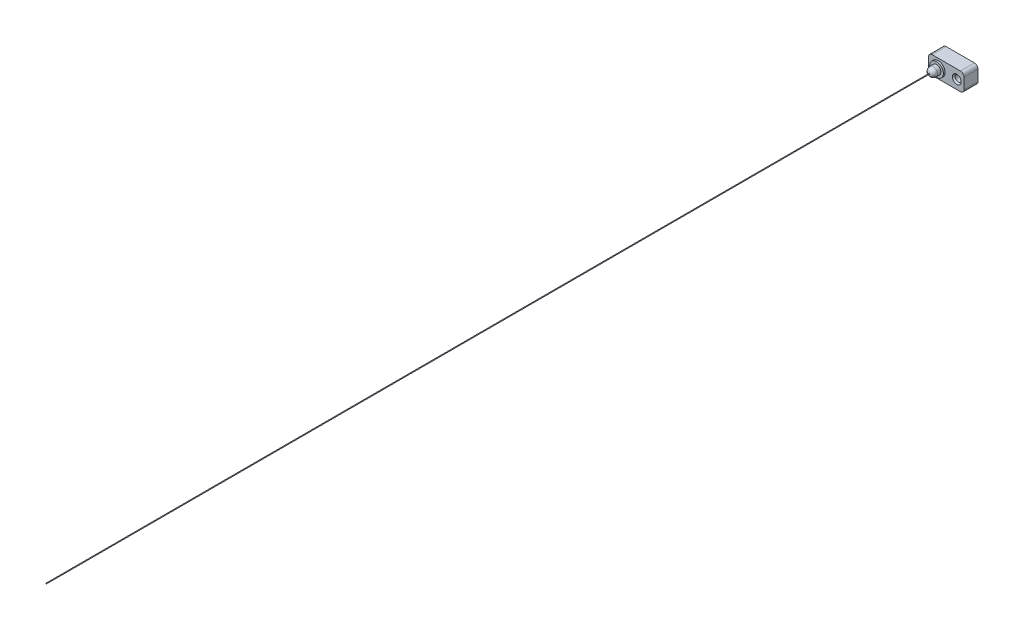
from build123d import *

# Parameters (mm, degrees)
SKETCH1_W                     = 20.066
SKETCH1_H                     = 10.16
BOSS_EXTRUDE1_DEPTH           = 7.9502
SKETCH2_R                     = 3.8862
BOSS_EXTRUDE2_DEPTH           = 0.9906
SKETCH3_R                     = 2.4765
BOSS_EXTRUDE3_DEPTH           = 4.2164
CSK_FOR_M3_SFHCS1_D           = 3.4
CSK_FOR_M3_SFHCS1_CSINK_D     = 5
CSK_FOR_M3_SFHCS1_CSINK_ANGLE = 90
FILLET1_R                     = 2.286
FILLET2_R                     = 2
SKETCH8_R                     = 0.1905
BOSS_EXTRUDE4_DEPTH           = 500


with BuildPart() as part:
    # Sketch1 → Boss-Extrude1 (new body)
    with BuildSketch(Plane.XY):
        with Locations((10.033, 5.08)):
            Rectangle(SKETCH1_W, SKETCH1_H)
    extrude(amount=BOSS_EXTRUDE1_DEPTH)

    # Sketch2 → Boss-Extrude2 (add)
    with BuildSketch(Plane.XY.offset(7.9502)):
        with Locations((5.5, 5.08)):
            Circle(SKETCH2_R)
    extrude(amount=BOSS_EXTRUDE2_DEPTH)

    # Sketch3 → Boss-Extrude3 (add)
    with BuildSketch(Plane.XY.offset(8.9408)):
        with Locations((5.5, 5.08)):
            Circle(SKETCH3_R)
    extrude(amount=BOSS_EXTRUDE3_DEPTH)

    # CSK for M3 SFHCS1 (through all)
    with Locations(Plane.XY.offset(7.9502)):
        with Locations((16, 5.08)):
            CounterSinkHole(CSK_FOR_M3_SFHCS1_D / 2, CSK_FOR_M3_SFHCS1_CSINK_D / 2, counter_sink_angle=CSK_FOR_M3_SFHCS1_CSINK_ANGLE)

    # Fillet1
    fillet1_edges = [part.edges().sort_by_distance(p)[0] for p in [
        (3.0235, 5.08, 13.1572),
    ]]
    fillet(fillet1_edges, radius=FILLET1_R)

    # Fillet2
    fillet2_edges = [part.edges().sort_by_distance(p)[0] for p in [
        (0, 0, 3.9751),
        (0, 10.16, 3.9751),
        (20.066, 0, 3.9751),
        (20.066, 10.16, 3.9751),
    ]]
    fillet(fillet2_edges, radius=FILLET2_R)


with BuildPart() as body_2:
    # Sketch8 → Boss-Extrude4 (new body)
    with BuildSketch(Plane.XY.offset(13.1572)):
        with Locations((5.5, 5.08)):
            Circle(SKETCH8_R)
    extrude(amount=BOSS_EXTRUDE4_DEPTH)


solid = Compound([part.part, body_2.part])
